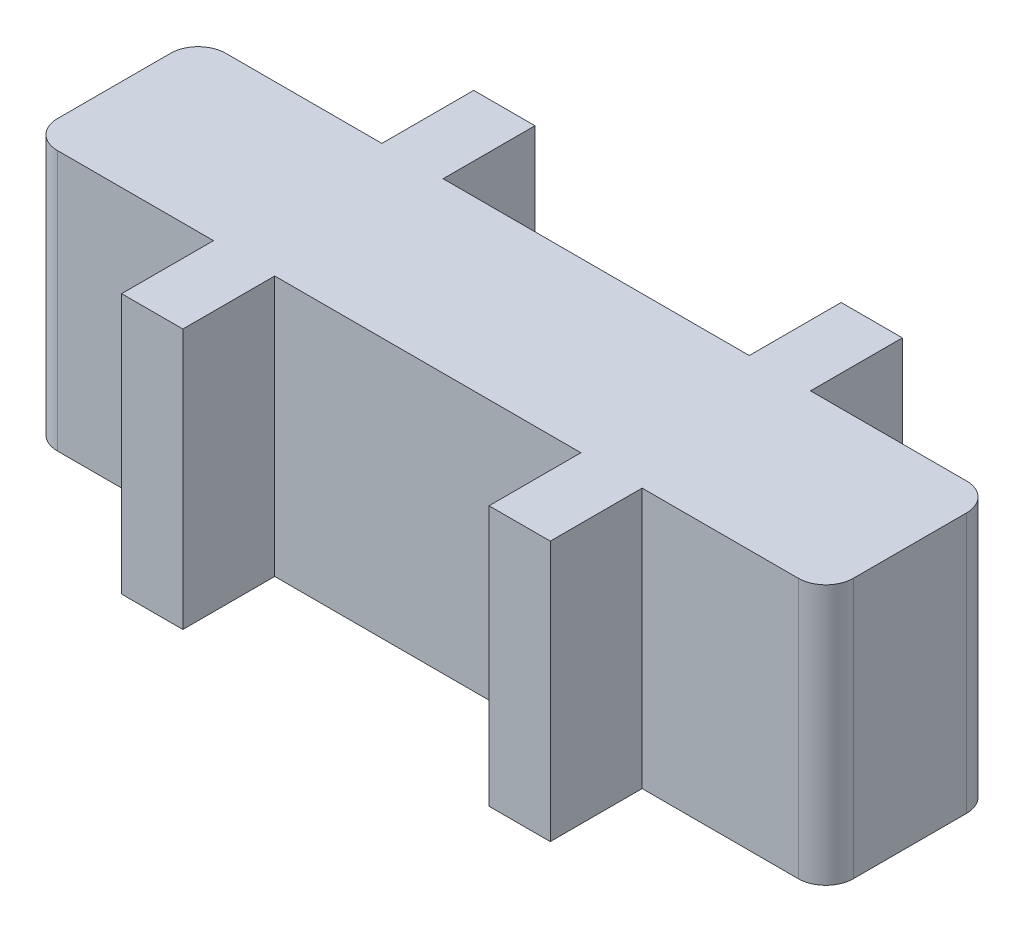
from build123d import *

# Parameters (mm, degrees)
BOSS_EXTRUDE1_DEPTH = 8.5
FILLET1_R           = 0.9


with BuildPart() as part:
    # Sketch1 → Boss-Extrude1 (new body)
    with BuildSketch(Plane(origin=(0, 0, 0), x_dir=(1, 0, 0), z_dir=(0, 1, 0))):
        Polygon((-13, 2.75), (-13, -2.75), (-7, -2.75), (-7, -5.75), (-5, -5.75), (-5, -2.75), (5, -2.75), (5, -5.75), (7, -5.75), (7, -2.75), (13, -2.75), (13, 2.75), (7, 2.75), (7, 5.75), (5, 5.75), (5, 2.75), (-5, 2.75), (-5, 5.75), (-7, 5.75), (-7, 2.75), align=None)
    extrude(amount=BOSS_EXTRUDE1_DEPTH)

    # Fillet1
    fillet1_edges = [part.edges().sort_by_distance(p)[0] for p in [
        (13, 4.25, -2.75),
        (13, 4.25, 2.75),
        (-13, 4.25, 2.75),
        (-13, 4.25, -2.75),
    ]]
    fillet(fillet1_edges, radius=FILLET1_R)


solid = part.part
